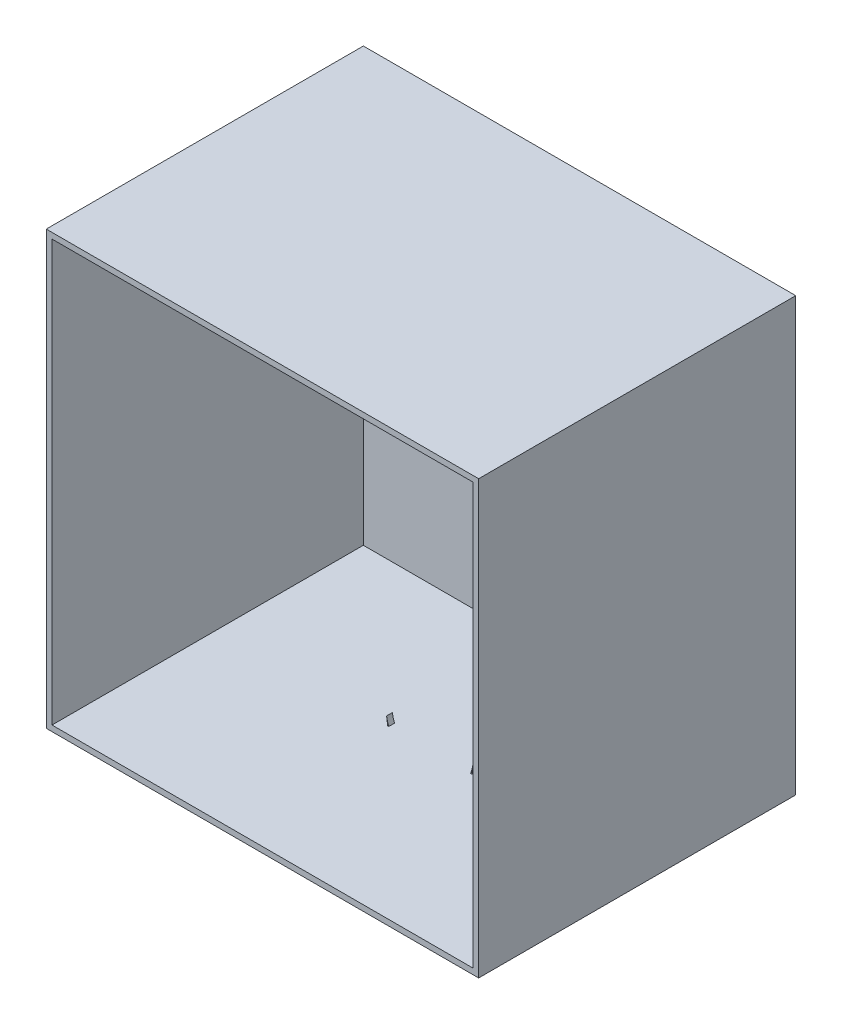
from build123d import *

# Parameters (mm, degrees)
SKETCH_1_W      = 150
SKETCH_1_H      = 150
EXTRUDE_1_DEPTH = 110
SHELL_1_T       = -2
EXTRUDE_START   = -60
EXTRUDE_2_DEPTH = 2
FILLET_1_R      = 10


with BuildPart() as part:
    # 草图1 → 凸台-拉伸1 (new body)
    with BuildSketch(Plane.XY):
        Rectangle(SKETCH_1_W, SKETCH_1_H)
    extrude(amount=EXTRUDE_1_DEPTH)

    # 抽壳1
    shell_1_openings = [part.faces().sort_by_distance(p)[0] for p in [
        (0, 0, 110),
    ]]
    offset(amount=SHELL_1_T, openings=shell_1_openings, kind=Kind.INTERSECTION)

    # 草图2 → 凸台-拉伸2 (add)
    with BuildSketch(Plane.XY.offset(110).offset(EXTRUDE_START)):
        with BuildLine():
            Line((-19.944653056, -75), (-17.301604129, -78.907070498))
            ThreePointArc((-17.301604129, -78.907070498), (-13.28346315, -82.348966768), (-8.071553148, -83.258967309))
            Line((-8.071553148, -83.258967309), (0, -82.490938419))
            Line((0, -82.490938419), (8.071553148, -83.258967309))
            ThreePointArc((8.071553148, -83.258967309), (13.28346315, -82.348966768), (17.301604129, -78.907070498))
            Line((17.301604129, -78.907070498), (19.944653056, -75))
            Line((19.944653056, -75), (14.314326214, -75))
            Line((14.314326214, -75), (14.932632038, -70.214502915))
            ThreePointArc((14.932632038, -70.214502915), (11.617573252, -76.443569186), (5.01506981, -78.933113254))
            Line((5.01506981, -78.933113254), (-5.01506981, -78.933113254))
            ThreePointArc((-5.01506981, -78.933113254), (-11.617573252, -76.443569186), (-14.932632038, -70.214502915))
            Line((-14.932632038, -70.214502915), (-14.314326214, -75))
            Line((-14.314326214, -75), (-19.944653056, -75))
        make_face()
    extrude(amount=EXTRUDE_2_DEPTH)

    # 圆角1
    # the kernel refuses this fillet: 10 mm, written as the material it adds along each edge
    with BuildSketch(Plane(origin=(19.944653056, -75, 50), x_dir=(1, 0, 0), z_dir=(0, 0, 1))) as fillet_1_piece_1:
        with BuildLine():
            CenterArc((5.297648539, -10), FILLET_1_R, 90, 54.21089853)
            Line((-2.814102182, -4.151966123), (-3.625277254, -3.567162735))
            ThreePointArc((-3.625277254, -3.567162735), (-3.471329325, -3.346756673), (-0.828280398, 0.560313825))
            Line((-0.828280398, 0.560313825), (0, 1))
            Line((0, 1), (5.297648539, 1))
            Line((5.297648539, 1), (5.297648539, 0))
        make_face()
    extrude(amount=2)
    with BuildSketch(Plane(origin=(-19.944653056, -75, 50), x_dir=(-1, 0, 0), z_dir=(0, 0, 1))) as fillet_1_piece_2:
        with BuildLine():
            CenterArc((5.297648539, 10), FILLET_1_R, 215.78910147, 54.21089853)
            Line((-2.814102182, 4.151966123), (-3.625277254, 3.567162735))
            ThreePointArc((-3.625277254, 3.567162735), (-3.471329325, 3.346756673), (-0.828280398, -0.560313825))
            Line((-0.828280398, -0.560313825), (0, -1))
            Line((0, -1), (5.297648539, -1))
            Line((5.297648539, -1), (5.297648539, 0))
        make_face()
    extrude(amount=2)


solid = part.part
